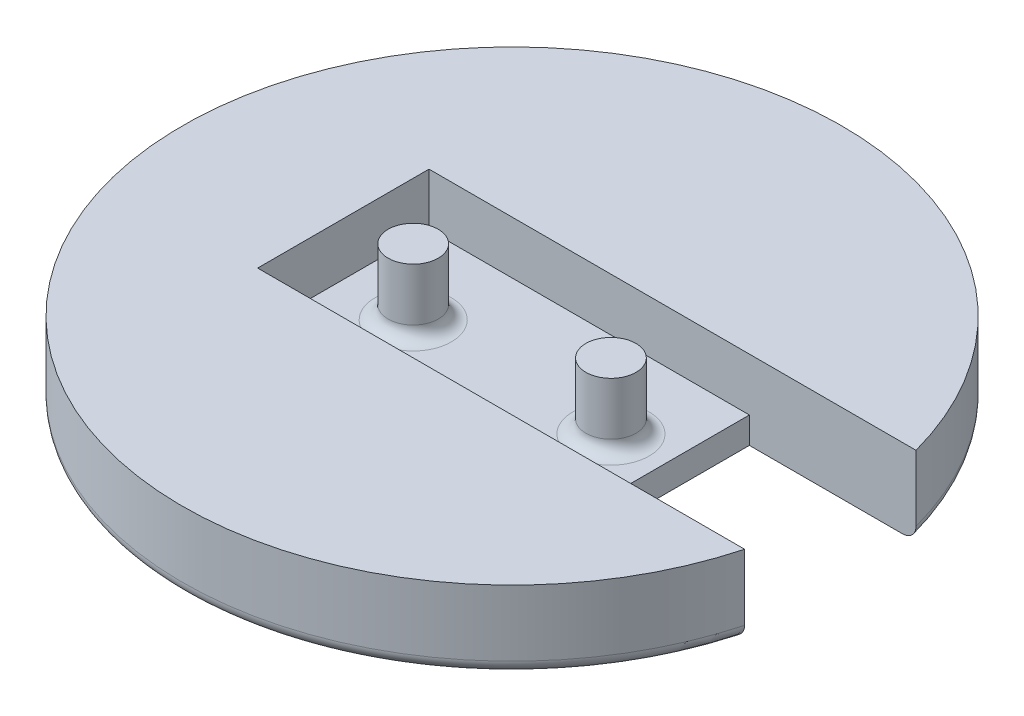
from build123d import *

# Parameters (mm, degrees)
SKETCH1_R           = 25
BOSS_EXTRUDE1_DEPTH = 2
BOSS_EXTRUDE2_DEPTH = 4
CUT_EXTRUDE1_REACH  = 37.581
SKETCH3_W           = 13.5
SKETCH3_H           = 13
SKETCH4_R           = 1.9
BOSS_EXTRUDE3_DEPTH = 5
FILLET1_R           = 1
FILLET2_R           = 1


with BuildPart() as part:
    # Sketch1 → Boss-Extrude1 (new body)
    with BuildSketch(Plane(origin=(0, 0, 0), x_dir=(1, 0, 0), z_dir=(0, 1, 0))):
        Circle(SKETCH1_R)
    extrude(amount=BOSS_EXTRUDE1_DEPTH)

    # Sketch2 → Boss-Extrude2 (add)
    with BuildSketch(Plane(origin=(0, 2, 0), x_dir=(1, 0, 0), z_dir=(0, 1, 0))):
        with BuildLine():
            Line((24.140215409, -6.5), (-12.8, -6.5))
            Line((-12.8, -6.5), (-12.8, 6.5))
            Line((-12.8, 6.5), (24.140215409, 6.5))
            ThreePointArc((24.140215409, 6.5), (-25, 0), (24.140215409, -6.5))
        make_face()
    extrude(amount=BOSS_EXTRUDE2_DEPTH)

    # Sketch3 → Cut-Extrude1 (cut, up to next)
    with BuildSketch(Plane(origin=(0, 2, 0), x_dir=(1, 0, 0), z_dir=(0, 1, 0)), mode=Mode.PRIVATE) as cut_extrude1_sk1:
        with Locations((18.25, 0)):
            Rectangle(SKETCH3_W, SKETCH3_H)
    cut_extrude1_tool1 = extrude(cut_extrude1_sk1.sketch, amount=-CUT_EXTRUDE1_REACH, mode=Mode.PRIVATE) & part.part
    add(cut_extrude1_tool1.solids().sort_by_distance((18.25, 2, 0))[0], mode=Mode.SUBTRACT)

    # Sketch4 → Boss-Extrude3 (add)
    with BuildSketch(Plane(origin=(0, 2, 0), x_dir=(1, 0, 0), z_dir=(0, 1, 0))):
        with Locations((7.5, 0)):
            Circle(SKETCH4_R)
        with Locations((-7.5, 0)):
            Circle(SKETCH4_R)
    extrude(amount=BOSS_EXTRUDE3_DEPTH)

    # Fillet1
    fillet1_edges = [part.edges().sort_by_distance(p)[0] for p in [
        (5.6, 2, 0),
        (-9.4, 2, 0),
    ]]
    fillet(fillet1_edges, radius=FILLET1_R)

    # Fillet2
    fillet2_edges = [part.edges().sort_by_distance(p)[0] for p in [
        (-25, 0, 0),
    ]]
    fillet(fillet2_edges, radius=FILLET2_R)


solid = part.part
